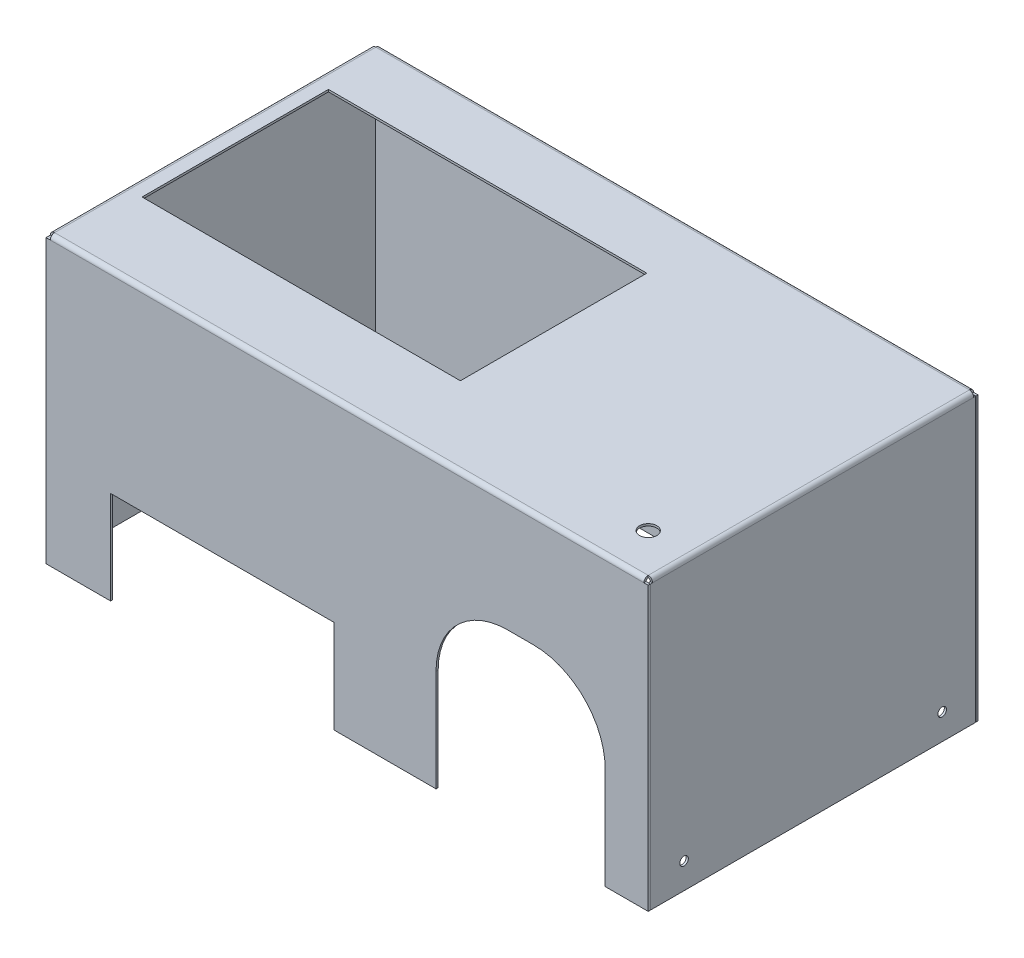
from build123d import *

# Parameters (mm, degrees)
BASE_FLANGE2_DEPTH       = 210
SKETCH8_R                = 6
SKETCH8_W                = 222
SKETCH8_H                = 130
CUT_EXTRUDE1_DEPTH       = 10
SKETCH14_W               = 156
SKETCH14_H               = 65
SKETCH14_W_2             = 118
SKETCH14_H_2             = 121
CUT_EXTRUDE2_DEPTH       = 10
EDGE_FLANGE1_START       = -115
EDGE_FLANGE1_DEPTH       = 230
EDGE_FLANGE1_2_DEPTH     = 3
EDGE_FLANGE1_START_2     = 112
EDGE_FLANGE1_3_DEPTH     = 3
EDGE_FLANGE1_START_3     = -112
EDGE_FLANGE1_4_DEPTH     = 224
CLOSED_START             = -129.163047535
CLOSED_CORNER1_OUTLINE_W = 1.5
CLOSED_CORNER1_OUTLINE_H = 1.4
CLOSED_CORNER1_DEPTH     = 197
SKETCH35_R               = 10.25
CUT_EXTRUDE4_DEPTH       = 210
FILLET1_R                = 50
SKETCH37_R               = 3
CUT_EXTRUDE5_DEPTH       = 580


# Read off the part's stored shape, not the designer's step: Edge-Flange1, Closed Corner1
# Sheet-metal steps are written as plain solids
with BuildPart() as part:
    # Sketch5 → Base-Flange2 (new, symmetric)
    with BuildSketch(Plane(origin=(0, 0, 0), x_dir=(0, 0, -1), z_dir=(1, 0, 0))):
        with BuildLine():
            Line((-115, -129.163047535), (-115, 67.836952465))
            ThreePointArc((-115, 67.836952465), (-114.121320344, 69.958272808), (-112, 70.836952465))
            Line((-112, 70.836952465), (112, 70.836952465))
            ThreePointArc((112, 70.836952465), (114.121320344, 69.958272808), (115, 67.836952465))
            Line((115, 67.836952465), (115, -129.163047535))
            Line((115, -129.163047535), (113.5, -129.163047535))
            Line((113.5, -129.163047535), (113.5, 67.836952465))
            ThreePointArc((113.5, 67.836952465), (113.060660172, 68.897612636), (112, 69.336952465))
            Line((112, 69.336952465), (-112, 69.336952465))
            ThreePointArc((-112, 69.336952465), (-113.060660172, 68.897612636), (-113.5, 67.836952465))
            Line((-113.5, 67.836952465), (-113.5, -129.163047535))
            Line((-113.5, -129.163047535), (-115, -129.163047535))
        make_face()
    extrude(amount=BASE_FLANGE2_DEPTH, both=True)

    # Sketch8 → Cut-Extrude1 (cut)
    with BuildSketch(Plane(origin=(0, 70.836952465, 0), x_dir=(1, 0, 0), z_dir=(0, 1, 0))):
        with Locations(Location((180, -85, 0), (0, 0, 270))):
            Circle(SKETCH8_R)
        with Locations((-87, 5)):
            Rectangle(SKETCH8_W, SKETCH8_H)
    extrude(amount=-CUT_EXTRUDE1_DEPTH, mode=Mode.SUBTRACT)

    # Sketch14 → Cut-Extrude2 (cut)
    with BuildSketch(Plane.XY.offset(115)):
        with Locations((-87, -96.663047535)):
            Rectangle(SKETCH14_W, SKETCH14_H)
        with Locations((121, -68.663047535)):
            Rectangle(SKETCH14_W_2, SKETCH14_H_2)
    extrude(amount=-CUT_EXTRUDE2_DEPTH, mode=Mode.SUBTRACT)

    # Edge-Flange1 outline → Edge-Flange1 (cut)
    with BuildSketch(Plane.XY.offset(EDGE_FLANGE1_START)):
        with BuildLine():
            Line((210, 67.836952465), (210, 70.836952465))
            Line((210, 70.836952465), (207, 70.836952465))
            ThreePointArc((207, 70.836952465), (209.121320344, 69.958272808), (210, 67.836952465))
        make_face()
        with BuildLine():
            Line((207, 67.836952465), (208.5, 67.836952465))
            ThreePointArc((208.5, 67.836952465), (208.060660172, 68.897612636), (207, 69.336952465))
            Line((207, 69.336952465), (207, 67.836952465))
        make_face()
        with BuildLine():
            Line((-207, 67.836952465), (-207, 69.336952465))
            ThreePointArc((-207, 69.336952465), (-208.060660172, 68.897612636), (-208.5, 67.836952465))
            Line((-208.5, 67.836952465), (-207, 67.836952465))
        make_face()
        with BuildLine():
            Line((-207, 70.836952465), (-210, 70.836952465))
            Line((-210, 70.836952465), (-210, 67.836952465))
            ThreePointArc((-210, 67.836952465), (-209.121320344, 69.958272808), (-207, 70.836952465))
        make_face()
    extrude(amount=EDGE_FLANGE1_DEPTH, mode=Mode.SUBTRACT)

    # Edge-Flange1 2 outline → Edge-Flange1 2 (cut)
    with BuildSketch(Plane.XY.offset(EDGE_FLANGE1_START)):
        with BuildLine():
            Line((208.5, 67.836952465), (210, 67.836952465))
            ThreePointArc((210, 67.836952465), (209.121320344, 69.958272808), (207, 70.836952465))
            Line((207, 70.836952465), (207, 69.336952465))
            ThreePointArc((207, 69.336952465), (208.060660172, 68.897612636), (208.5, 67.836952465))
        make_face()
        with BuildLine():
            ThreePointArc((-207, 70.836952465), (-209.121320344, 69.958272808), (-210, 67.836952465))
            Line((-210, 67.836952465), (-208.5, 67.836952465))
            ThreePointArc((-208.5, 67.836952465), (-208.060660172, 68.897612636), (-207, 69.336952465))
            Line((-207, 69.336952465), (-207, 70.836952465))
        make_face()
    extrude(amount=EDGE_FLANGE1_2_DEPTH, mode=Mode.SUBTRACT)

    # Edge-Flange1 3 outline → Edge-Flange1 3 (cut)
    with BuildSketch(Plane.XY.offset(EDGE_FLANGE1_START_2)):
        with BuildLine():
            Line((208.5, 67.836952465), (210, 67.836952465))
            ThreePointArc((210, 67.836952465), (209.121320344, 69.958272808), (207, 70.836952465))
            Line((207, 70.836952465), (207, 69.336952465))
            ThreePointArc((207, 69.336952465), (208.060660172, 68.897612636), (208.5, 67.836952465))
        make_face()
        with BuildLine():
            ThreePointArc((-207, 70.836952465), (-209.121320344, 69.958272808), (-210, 67.836952465))
            Line((-210, 67.836952465), (-208.5, 67.836952465))
            ThreePointArc((-208.5, 67.836952465), (-208.060660172, 68.897612636), (-207, 69.336952465))
            Line((-207, 69.336952465), (-207, 70.836952465))
        make_face()
    extrude(amount=EDGE_FLANGE1_3_DEPTH, mode=Mode.SUBTRACT)

    # Edge-Flange1 4 outline → Edge-Flange1 4 (add)
    with BuildSketch(Plane.XY.offset(EDGE_FLANGE1_START_3)):
        with BuildLine():
            Line((210, -129.163047535), (210, 67.836952465))
            ThreePointArc((210, 67.836952465), (209.897777479, 68.6134096), (209.598076211, 69.336952465))
            Line((209.598076211, 69.336952465), (207, 69.336952465))
            ThreePointArc((207, 69.336952465), (208.060660172, 68.897612636), (208.5, 67.836952465))
            Line((208.5, 67.836952465), (208.5, -129.163047535))
            Line((208.5, -129.163047535), (210, -129.163047535))
        make_face()
        with BuildLine():
            ThreePointArc((-208.5, 67.836952465), (-208.060660172, 68.897612636), (-207, 69.336952465))
            Line((-207, 69.336952465), (-209.598076211, 69.336952465))
            ThreePointArc((-209.598076211, 69.336952465), (-209.897777479, 68.6134096), (-210, 67.836952465))
            Line((-210, 67.836952465), (-210, -129.163047535))
            Line((-210, -129.163047535), (-208.5, -129.163047535))
            Line((-208.5, -129.163047535), (-208.5, 67.836952465))
        make_face()
    extrude(amount=EDGE_FLANGE1_4_DEPTH)

    # Closed Corner1 outline → Closed Corner1 (add)
    with BuildSketch(Plane(origin=(0, 0, 0), x_dir=(1, 0, 0), z_dir=(0, 1, 0)).offset(CLOSED_START)):
        with Locations((-209.25, -112.7)):
            Rectangle(CLOSED_CORNER1_OUTLINE_W, CLOSED_CORNER1_OUTLINE_H)
        with Locations((-209.25, 112.7)):
            Rectangle(CLOSED_CORNER1_OUTLINE_W, CLOSED_CORNER1_OUTLINE_H)
        with Locations((209.25, -112.7)):
            Rectangle(CLOSED_CORNER1_OUTLINE_W, CLOSED_CORNER1_OUTLINE_H)
        with Locations((209.25, 112.7)):
            Rectangle(CLOSED_CORNER1_OUTLINE_W, CLOSED_CORNER1_OUTLINE_H)
    extrude(amount=CLOSED_CORNER1_DEPTH)

    # Sketch35 → Cut-Extrude4 (cut)
    with BuildSketch(Plane(origin=(95, 0, -115), x_dir=(1, 0, 0), z_dir=(0, 0, 1))):
        with Locations(Location((95, -109.163047535, 0), (0, 0, 270))):
            Circle(SKETCH35_R)
    extrude(amount=CUT_EXTRUDE4_DEPTH, mode=Mode.SUBTRACT)

    # Fillet1
    fillet1_edges = [part.edges().sort_by_distance(p)[0] for p in [
        (180, -8.163047535, 114.25),
        (62, -8.163047535, 114.25),
    ]]
    fillet(fillet1_edges, radius=FILLET1_R)

    # Sketch37 → Cut-Extrude5 (cut)
    with BuildSketch(Plane(origin=(210, 0, 0), x_dir=(0, 0, -1), z_dir=(1, 0, 0))):
        with Locations(Location((-90, -111.163047535, 0), (0, 0, 90))):
            Circle(SKETCH37_R)
        with Locations(Location((90, -111.163047535, 0), (0, 0, 270))):
            Circle(SKETCH37_R)
    extrude(amount=-CUT_EXTRUDE5_DEPTH, mode=Mode.SUBTRACT)


solid = part.part
